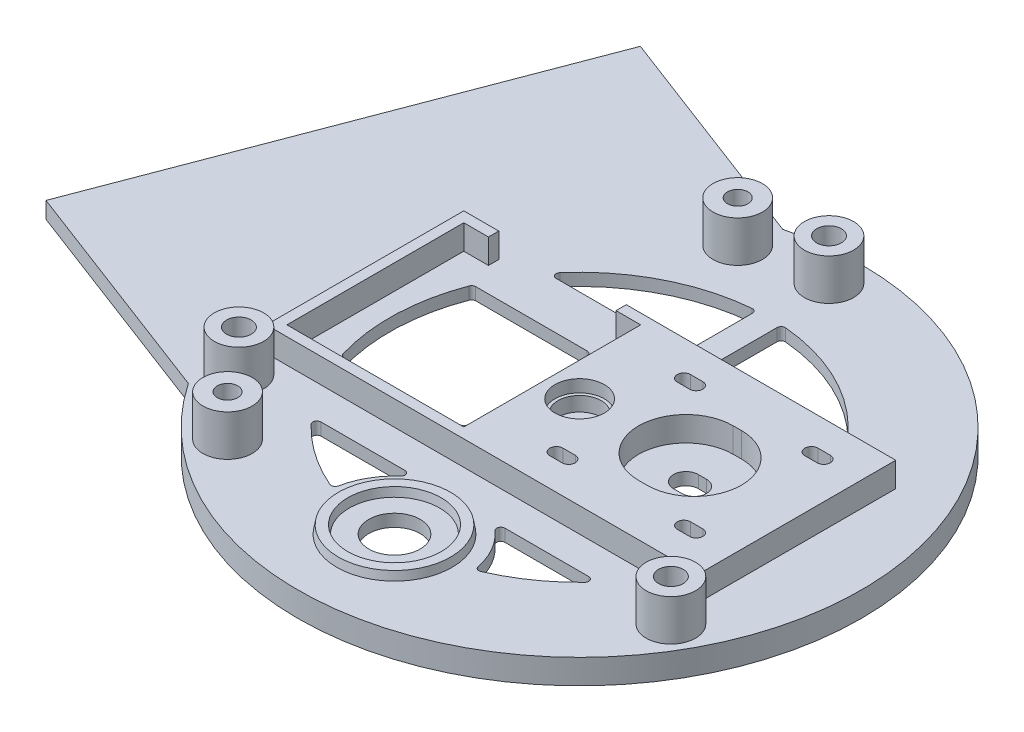
from build123d import *

# Parameters (mm, degrees)
SKETCH2_R           = 6
SKETCH2_R_2         = 3
SKETCH2_R_3         = 2.5
BOSS_EXTRUDE1_DEPTH = 10
SKETCH3_R           = 6.25
CUT_EXTRUDE1_DEPTH  = 10
SKETCH4_R           = 14
SKETCH4_R_2         = 11
BOSS_EXTRUDE2_DEPTH = 2
BOSS_EXTRUDE2_DRAFT = 10
BOSS_EXTRUDE3_DEPTH = 6
BOSS_EXTRUDE5_START = -4
BOSS_EXTRUDE5_DEPTH = 4
CUT_EXTRUDE2_DEPTH  = 144.36584134
CUT_EXTRUDE3_DEPTH  = 144.030641693
SKETCH8_R           = 1.75
CUT_EXTRUDE4_DEPTH  = 144.36584134
CHAMFER1_SIZE       = 2
SKETCH9_R           = 5.25
CUT_EXTRUDE5_DEPTH  = 6.5
SKETCH10_R          = 6
CUT_EXTRUDE6_DEPTH  = 3
CUT_EXTRUDE7_DEPTH  = 144.030641693


with BuildPart() as part:
    # Sketch1 → Revolve1 (revolve)
    with BuildSketch(Plane.XY):
        with BuildLine():
            Line((0, 0), (68.5, 0))
            Line((68.5, 0), (68.5, -6))
            Line((68.5, -6), (66.5, -6))
            Line((66.5, -6), (66.5, -3))
            Line((66.5, -3), (62.351595203, -3))
            ThreePointArc((62.351595203, -3), (60, -2.3), (57.648404797, -3))
            Line((57.648404797, -3), (53.5, -3))
            Line((53.5, -3), (53.5, -6))
            Line((53.5, -6), (50.5, -6))
            Line((50.5, -6), (50.5, -3))
            Line((50.5, -3), (8, -3))
            Line((8, -3), (8, -8))
            Line((8, -8), (0, -8))
            Line((0, -8), (0, 0))
        make_face()
    revolve(axis=Axis((0, -8, 0), (0, 1, 0)))

    # Sketch2 → Boss-Extrude1 (add)
    # profile 1 of 5: a face of its own
    with BuildSketch(Plane(origin=(0, 0, 0), x_dir=(1, 0, 0), z_dir=(0, 1, 0))):
        with Locations((0, 60.621778265)):
            Circle(SKETCH2_R)
        with Locations((0, 60.621778265)):
            Circle(SKETCH2_R_2, mode=Mode.SUBTRACT)
    # profile 2 of 5: a face of its own
    with BuildSketch(Plane(origin=(0, 0, 0), x_dir=(1, 0, 0), z_dir=(0, 1, 0))):
        with Locations((52.5, -30.310889132)):
            Circle(SKETCH2_R)
        with Locations((52.5, -30.310889132)):
            Circle(SKETCH2_R_2, mode=Mode.SUBTRACT)
    # profile 3 of 5: a face of its own
    with BuildSketch(Plane(origin=(0, 0, 0), x_dir=(1, 0, 0), z_dir=(0, 1, 0))):
        with Locations((-52.5, -30.310889132)):
            Circle(SKETCH2_R)
        with Locations((-52.5, -30.310889132)):
            Circle(SKETCH2_R_2, mode=Mode.SUBTRACT)
    # profile 4 of 5: a face of its own
    with BuildSketch(Plane(origin=(0, 0, 0), x_dir=(1, 0, 0), z_dir=(0, 1, 0))):
        with Locations((-40.273109217, -45.310889132)):
            Circle(SKETCH2_R)
        with Locations((-40.273109217, -45.310889132)):
            Circle(SKETCH2_R_3, mode=Mode.SUBTRACT)
    # profile 5 of 5: a face of its own
    with BuildSketch(Plane(origin=(0, 0, 0), x_dir=(1, 0, 0), z_dir=(0, 1, 0))):
        with Locations((-19.103826448, 57.532980238)):
            Circle(SKETCH2_R)
        with Locations((-19.103826448, 57.532980238)):
            Circle(SKETCH2_R_3, mode=Mode.SUBTRACT)
    extrude(amount=BOSS_EXTRUDE1_DEPTH)

    # Sketch3 → Cut-Extrude1 (cut)
    with BuildSketch(Plane(origin=(0, 0, 0), x_dir=(1, 0, 0), z_dir=(0, 1, 0))):
        with Locations((0, -45)):
            Circle(SKETCH3_R)
    extrude(amount=-CUT_EXTRUDE1_DEPTH, mode=Mode.SUBTRACT)


with BuildPart() as boss_extrude2_tool:
    # Sketch4 → Boss-Extrude2 (with draft: the straight prism first)
    with BuildSketch(Plane(origin=(0, 0, 0), x_dir=(1, 0, 0), z_dir=(0, 1, 0))):
        with Locations((0, -45)):
            Circle(SKETCH4_R)
        with Locations((0, -45)):
            Circle(SKETCH4_R_2, mode=Mode.SUBTRACT)
    extrude(amount=BOSS_EXTRUDE2_DEPTH)
    # Boss-Extrude2: the draft: its side faces are tilted about the plane it starts from
    boss_extrude2_sides = [boss_extrude2_tool.faces().sort_by_distance(p)[0] for p in [
        (-14, 1, 45),
        (-11, 1, 45),
    ]]
    draft(boss_extrude2_sides, Plane(origin=(0, 0, 0), x_dir=(1, 0, 0), z_dir=(0, 1, 0)), BOSS_EXTRUDE2_DRAFT)


with BuildPart() as part_1:
    add(part.part)

    # Boss-Extrude2: add boss_extrude2_tool
    add(boss_extrude2_tool.part)

    # Sketch5 → Boss-Extrude3 (add)
    with BuildSketch(Plane(origin=(0, 0, 0), x_dir=(1, 0, 0), z_dir=(0, 1, 0))):
        Polygon((51.356277967, -22.510312898), (51.356277967, 25.489687102), (-14.143722033, 25.489687102), (-14.143722033, 22.989687102), (-8.143722033, 22.989687102), (-8.143722033, -20.010312898), (-51.143722033, -20.010312898), (-51.143722033, 22.989687102), (-45.143722033, 22.989687102), (-45.143722033, 25.489687102), (-53.643722033, 25.489687102), (-53.643722033, -22.510312898), align=None)
        with BuildLine():
            Line((26.356277967, -10.010312898), (24.356277967, -10.010312898))
            ThreePointArc((24.356277967, -10.010312898), (12.856277967, 1.489687102), (24.356277967, 12.989687102))
            Line((24.356277967, 12.989687102), (26.356277967, 12.989687102))
            ThreePointArc((26.356277967, 12.989687102), (37.856277967, 1.489687102), (26.356277967, -10.010312898))
        make_face(mode=Mode.SUBTRACT)
    extrude(amount=BOSS_EXTRUDE3_DEPTH)

    # Sketch12 → Boss-Extrude5 (add)
    with BuildSketch(Plane(origin=(0, 0, 0), x_dir=(1, 0, 0), z_dir=(0, 1, 0)).offset(BOSS_EXTRUDE5_START)):
        with BuildLine():
            Line((-56.774695686, -38.326021575), (-112.625732512, -17.092770669))
            Line((-112.625732512, -17.092770669), (-72.825198892, 87.596854049))
            Line((-72.825198892, 87.596854049), (-16.974162066, 66.363603143))
            ThreePointArc((-16.974162066, 66.363603143), (-64.028922261, 24.342290651), (-56.774695686, -38.326021575))
        make_face()
    extrude(amount=BOSS_EXTRUDE5_DEPTH)

    # Sketch6 → Cut-Extrude2 (cut, through all)
    with BuildSketch(Plane(origin=(0, 6, 0), x_dir=(1, 0, 0), z_dir=(0, 1, 0))):
        with BuildLine():
            Line((11.356277967, -15.610312898), (8.356277967, -15.610312898))
            ThreePointArc((8.356277967, -15.610312898), (6.756277967, -14.010312898), (8.356277967, -12.410312898))
            Line((8.356277967, -12.410312898), (11.356277967, -12.410312898))
            ThreePointArc((11.356277967, -12.410312898), (12.956277967, -14.010312898), (11.356277967, -15.610312898))
        make_face()
        with BuildLine():
            Line((42.356277967, -15.610312898), (39.356277967, -15.610312898))
            ThreePointArc((39.356277967, -15.610312898), (37.756277967, -14.010312898), (39.356277967, -12.410312898))
            Line((39.356277967, -12.410312898), (42.356277967, -12.410312898))
            ThreePointArc((42.356277967, -12.410312898), (43.956277967, -14.010312898), (42.356277967, -15.610312898))
        make_face()
        with BuildLine():
            Line((42.356277967, 15.389687102), (39.356277967, 15.389687102))
            ThreePointArc((39.356277967, 15.389687102), (37.756277967, 16.989687102), (39.356277967, 18.589687102))
            Line((39.356277967, 18.589687102), (42.356277967, 18.589687102))
            ThreePointArc((42.356277967, 18.589687102), (43.956277967, 16.989687102), (42.356277967, 15.389687102))
        make_face()
        with BuildLine():
            Line((11.356277967, 15.389687102), (8.356277967, 15.389687102))
            ThreePointArc((8.356277967, 15.389687102), (6.756277967, 16.989687102), (8.356277967, 18.589687102))
            Line((8.356277967, 18.589687102), (11.356277967, 18.589687102))
            ThreePointArc((11.356277967, 18.589687102), (12.956277967, 16.989687102), (11.356277967, 15.389687102))
        make_face()
    extrude(amount=-CUT_EXTRUDE2_DEPTH, mode=Mode.SUBTRACT)

    # Sketch7 → Cut-Extrude3 (cut, through all)
    with BuildSketch(Plane(origin=(0, 0, 0), x_dir=(1, 0, 0), z_dir=(0, 1, 0))):
        with BuildLine():
            Line((26.356277967, -1.510312898), (24.356277967, -1.510312898))
            ThreePointArc((24.356277967, -1.510312898), (21.356277967, 1.489687102), (24.356277967, 4.489687102))
            Line((24.356277967, 4.489687102), (26.356277967, 4.489687102))
            ThreePointArc((26.356277967, 4.489687102), (29.356277967, 1.489687102), (26.356277967, -1.510312898))
        make_face()
    extrude(amount=-CUT_EXTRUDE3_DEPTH, mode=Mode.SUBTRACT)

    # Sketch8 → Cut-Extrude4 (cut, through all)
    with BuildSketch(Plane(origin=(0, 6, 0), x_dir=(1, 0, 0), z_dir=(0, 1, 0))):
        Circle(SKETCH8_R)
    extrude(amount=-CUT_EXTRUDE4_DEPTH, mode=Mode.SUBTRACT)

    # Chamfer1
    chamfer1_edges = [part_1.edges().sort_by_distance(p)[0] for p in [
        (37.756277967, -3, 14.010312898),
        (40.856277967, -3, 12.410312898),
        (40.856277967, -3, 15.610312898),
        (43.956277967, -3, 14.010312898),
        (37.756277967, -3, -16.989687102),
        (40.856277967, -3, -18.589687102),
        (40.856277967, -3, -15.389687102),
        (43.956277967, -3, -16.989687102),
        (6.756277967, -3, -16.989687102),
        (9.856277967, -3, -18.589687102),
        (9.856277967, -3, -15.389687102),
        (12.956277967, -3, -16.989687102),
        (6.756277967, -3, 14.010312898),
        (9.856277967, -3, 12.410312898),
        (9.856277967, -3, 15.610312898),
        (12.956277967, -3, 14.010312898),
    ]]
    chamfer(chamfer1_edges, length=CHAMFER1_SIZE)

    # Sketch9 → Cut-Extrude5 (cut)
    with BuildSketch(Plane(origin=(0, 6, 0), x_dir=(1, 0, 0), z_dir=(0, 1, 0))):
        Circle(SKETCH9_R)
    extrude(amount=-CUT_EXTRUDE5_DEPTH, mode=Mode.SUBTRACT)

    # Sketch10 → Cut-Extrude6 (cut)
    with BuildSketch(Plane(origin=(0, 6, 0), x_dir=(1, 0, 0), z_dir=(0, 1, 0))):
        Circle(SKETCH10_R)
    extrude(amount=-CUT_EXTRUDE6_DEPTH, mode=Mode.SUBTRACT)

    # Sketch11 → Cut-Extrude7 (cut, through all)
    with BuildSketch(Plane(origin=(0, 0, 0), x_dir=(1, 0, 0), z_dir=(0, 1, 0))):
        with BuildLine():
            Line((-14.143722033, -13.010312898), (-14.143722033, 15.989687102))
            ThreePointArc((-14.143722033, 15.989687102), (-14.436615252, 16.696793883), (-15.143722033, 16.989687102))
            Line((-15.143722033, 16.989687102), (-42.243050857, 16.989687102))
            ThreePointArc((-42.243050857, 16.989687102), (-42.811379545, 16.81248872), (-43.178294385, 16.343692106))
            ThreePointArc((-43.178294385, 16.343692106), (-46.13996215, 1.607877625), (-44.211255475, -13.2983558))
            ThreePointArc((-44.211255475, -13.2983558), (-43.850277349, -13.812822369), (-43.253637969, -14.010312898))
            Line((-43.253637969, -14.010312898), (-15.143722033, -14.010312898))
            ThreePointArc((-15.143722033, -14.010312898), (-14.436615252, -13.717419679), (-14.143722033, -13.010312898))
        make_face()
        with BuildLine():
            Line((3, 29.489687102), (3, 44.990503879))
            ThreePointArc((3, 44.990503879), (3.324929016, 45.72825666), (4.088558332, 45.986574871))
            ThreePointArc((4.088558332, 45.986574871), (21.074922748, 41.077110522), (34.970079512, 30.142576476))
            ThreePointArc((34.970079512, 30.142576476), (35.121716268, 29.073087398), (34.212626235, 28.489687102))
            Line((34.212626235, 28.489687102), (4, 28.489687102))
            ThreePointArc((4, 28.489687102), (3.292893219, 28.782580321), (3, 29.489687102))
        make_face()
        with BuildLine():
            Line((-3, 29.489687102), (-3, 44.990503879))
            ThreePointArc((-3, 44.990503879), (-3.324929016, 45.72825666), (-4.088558332, 45.986574871))
            ThreePointArc((-4.088558332, 45.986574871), (-21.074922748, 41.077110522), (-34.970079512, 30.142576476))
            ThreePointArc((-34.970079512, 30.142576476), (-35.121716268, 29.073087398), (-34.212626235, 28.489687102))
            Line((-34.212626235, 28.489687102), (-4, 28.489687102))
            ThreePointArc((-4, 28.489687102), (-3.292893219, 28.782580321), (-3, 29.489687102))
        make_face()
        with BuildLine():
            Line((-32.554165033, -30.310889132), (-12.146264233, -30.310889132))
            ThreePointArc((-12.146264233, -30.310889132), (-11.211384175, -30.955925362), (-11.482567133, -32.058890576))
            ThreePointArc((-11.482567133, -32.058890576), (-15.012196927, -36.400255555), (-16.971716901, -41.641058721))
            ThreePointArc((-16.971716901, -41.641058721), (-17.487961186, -42.332364065), (-18.350154163, -42.364527848))
            ThreePointArc((-18.350154163, -42.364527848), (-26.327194919, -37.925719312), (-33.27490067, -32.004099159))
            ThreePointArc((-33.27490067, -32.004099159), (-33.474276447, -30.919232412), (-32.554165033, -30.310889132))
        make_face()
        with BuildLine():
            Line((12.146264233, -30.310889132), (32.554165033, -30.310889132))
            ThreePointArc((32.554165033, -30.310889132), (33.474276447, -30.919232412), (33.27490067, -32.004099159))
            ThreePointArc((33.27490067, -32.004099159), (26.327194919, -37.925719312), (18.350154163, -42.364527848))
            ThreePointArc((18.350154163, -42.364527848), (17.487961186, -42.332364065), (16.971716901, -41.641058721))
            ThreePointArc((16.971716901, -41.641058721), (15.012196927, -36.400255555), (11.482567133, -32.058890576))
            ThreePointArc((11.482567133, -32.058890576), (11.211384175, -30.955925362), (12.146264233, -30.310889132))
        make_face()
    extrude(amount=-CUT_EXTRUDE7_DEPTH, mode=Mode.SUBTRACT)


solid = part_1.part
